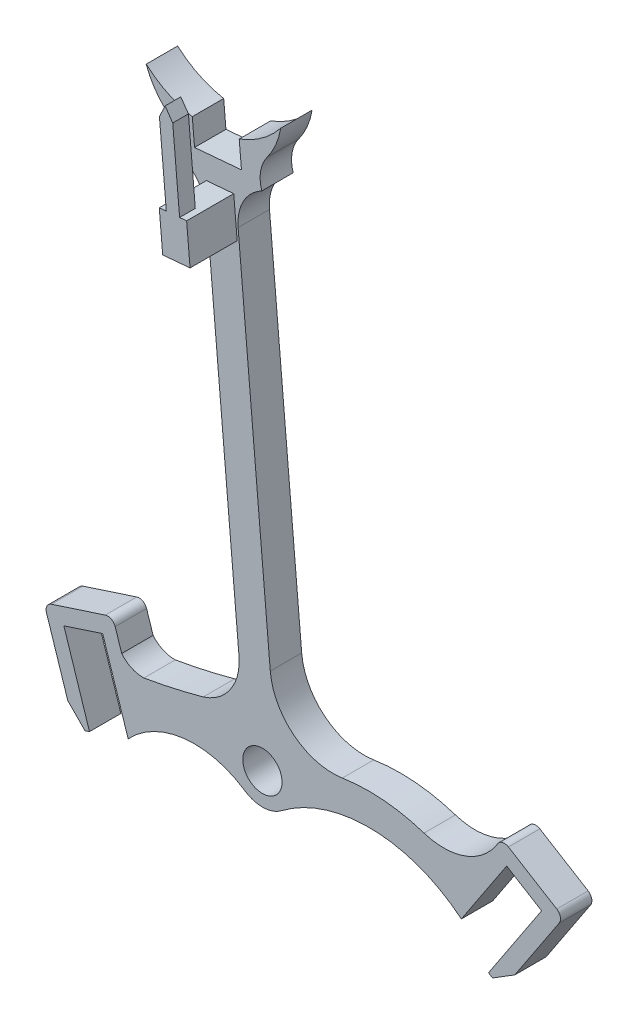
from build123d import *

# Parameters (mm, degrees)
BOSS_EXTRUDE1_OUTLINE_R = 0.25
BOSS_EXTRUDE1_DEPTH     = 0.4
BOSS_EXTRUDE2_DEPTH     = 1
BOSS_EXTRUDE3_START     = 0.8
BOSS_EXTRUDE3_DEPTH     = 0.2


# Read off the part's stored shape, not the designer's step: Boss-Extrude1
with BuildPart() as part:
    # Boss-Extrude1 outline → Boss-Extrude1 (new body)
    with BuildSketch(Plane.XY):
        with BuildLine():
            ThreePointArc((0.232880573, 11.939538652), (-0.004933085, 11.711410613), (-0.295707305, 11.556336146))
            Line((-0.295707305, 11.556336146), (-0.267193244, 11.23041893))
            Line((-0.267193244, 11.23041893), (-0.864910062, 11.178125485))
            Line((-0.864910062, 11.178125485), (-0.893424124, 11.5040427))
            ThreePointArc((-0.893424124, 11.5040427), (-1.206709229, 11.606268825), (-1.480523981, 11.789635178))
            ThreePointArc((-1.480523981, 11.789635178), (-1.381646187, 11.58978807), (-1.238910718, 11.418492212))
            ThreePointArc((-1.238910718, 11.418492212), (-1.124081641, 11.241613378), (-1.102444702, 11.031842833))
            ThreePointArc((-1.102444702, 11.031842833), (-0.830623384, 10.84424284), (-0.708470889, 10.537388877))
            Line((-0.708470889, 10.537388877), (-0.298379869, 5.850027068))
            ThreePointArc((-0.298379869, 5.850027068), (-0.406499279, 5.430691492), (-0.75404158, 5.172338089))
            ThreePointArc((-0.75404158, 5.172338089), (-1.129720091, 5.078868092), (-1.509480558, 5.003681847))
            ThreePointArc((-1.509480558, 5.003681847), (-1.666132979, 5.034974657), (-1.792562668, 5.132620725))
            Line((-1.792562668, 5.132620725), (-1.875378571, 5.387501866))
            ThreePointArc((-1.875378571, 5.387501866), (-1.925085173, 5.445700819), (-2.001385922, 5.451705818))
            Line((-2.001385922, 5.451705818), (-2.686146614, 5.229213582))
            ThreePointArc((-2.686146614, 5.229213582), (-2.744345567, 5.179506981), (-2.750350566, 5.103206231))
            Line((-2.750350566, 5.103206231), (-2.479687932, 4.270192298))
            Line((-2.479687932, 4.270192298), (-2.259859524, 4.046679542))
            Line((-2.259859524, 4.046679542), (-2.202796133, 4.065220562))
            Line((-2.202796133, 4.065220562), (-2.529237563, 5.069903979))
            Line((-2.529237563, 5.069903979), (-2.034688175, 5.230592816))
            Line((-2.034688175, 5.230592816), (-1.710220331, 4.231983473))
            ThreePointArc((-1.710220331, 4.231983473), (-0.998592576, 4.592140334), (-0.223827126, 4.40275838))
            ThreePointArc((-0.223827126, 4.40275838), (0.010695557, 4.334415883), (0.241228985, 4.415198467))
            ThreePointArc((0.241228985, 4.415198467), (1.395767253, 4.789072574), (2.533587129, 4.367045296))
            Line((2.533587129, 4.367045296), (3.111517477, 5.240202804))
            Line((3.111517477, 5.240202804), (3.555740915, 4.968344082))
            Line((3.555740915, 4.968344082), (2.879966638, 3.947360522))
            Line((2.879966638, 3.947360522), (2.929999788, 3.914244302))
            Line((2.929999788, 3.914244302), (3.214623401, 4.09061153))
            Line((3.214623401, 4.09061153), (3.779706708, 4.944359277))
            ThreePointArc((3.779706708, 4.944359277), (3.793941313, 5.021225846), (3.748517476, 5.084847921))
            Line((3.748517476, 5.084847921), (3.133596604, 5.46117116))
            ThreePointArc((3.133596604, 5.46117116), (3.059724383, 5.473499401), (2.998008671, 5.431069912))
            Line((2.998008671, 5.431069912), (2.974770776, 5.395961283))
            ThreePointArc((2.974770776, 5.395961283), (2.570340353, 5.081865355), (2.058285642, 5.077371822))
            ThreePointArc((2.058285642, 5.077371822), (1.543060021, 5.181767476), (1.017672926, 5.163759347))
            ThreePointArc((1.017672926, 5.163759347), (0.40272096, 5.32561867), (0.10009801, 5.884889365))
            Line((0.10009801, 5.884889365), (-0.30999301, 10.572251175))
            ThreePointArc((-0.30999301, 10.572251175), (-0.242980918, 10.895654894), (-0.007865573, 11.127606098))
            ThreePointArc((-0.007865573, 11.127606098), (-0.022983621, 11.337946973), (0.059386258, 11.53207848))
            ThreePointArc((0.059386258, 11.53207848), (0.170208041, 11.725557722), (0.232880573, 11.939538652))
        make_face()
        with Locations((0, 4.734272207)):
            Circle(BOSS_EXTRUDE1_OUTLINE_R, mode=Mode.SUBTRACT)
    extrude(amount=BOSS_EXTRUDE1_DEPTH)

    # Sketch1<8> → Boss-Extrude2 (add)
    with BuildSketch(Plane.XY):
        Polygon((-0.365402387, 10.918740425), (-0.321824516, 10.420643076), (-0.67049266, 10.390138566), (-0.714070532, 10.888235915), align=None)
    extrude(amount=BOSS_EXTRUDE2_DEPTH)

    # Sketch1<9> → Boss-Extrude3 (add)
    with BuildSketch(Plane.XY.offset(BOSS_EXTRUDE3_START)):
        Polygon((-0.624413009, 10.896079932), (-0.45505991, 10.910896408), (-0.54245757, 11.909856226), (-0.639965564, 12.049112073), (-0.711810668, 11.895039749), align=None)
    extrude(amount=BOSS_EXTRUDE3_DEPTH)


solid = part.part
